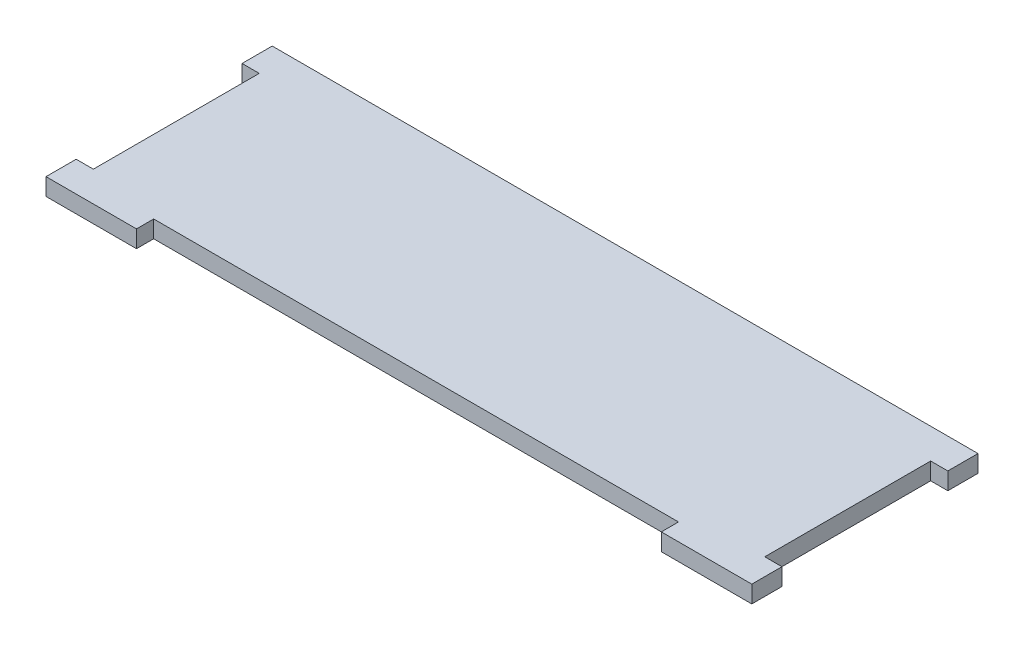
from build123d import *

# Parameters (mm, degrees)
SKETCH1_W           = 234
SKETCH1_H           = 75
BOSS_EXTRUDE1_DEPTH = 5.7
SKETCH2_W           = 5.7
SKETCH2_H           = 55
CUT_EXTRUDE1_DEPTH  = 5.7
SKETCH3_W           = 174
SKETCH3_H           = 5.7
CUT_EXTRUDE2_DEPTH  = 5.7


with BuildPart() as part:
    # Sketch1 → Boss-Extrude1 (new body)
    with BuildSketch(Plane(origin=(0, 0, 0), x_dir=(1, 0, 0), z_dir=(0, 1, 0))):
        with Locations((117, 37.5)):
            Rectangle(SKETCH1_W, SKETCH1_H)
    extrude(amount=BOSS_EXTRUDE1_DEPTH)

    # Sketch2 → Cut-Extrude1 (cut)
    with BuildSketch(Plane(origin=(0, 5.7, 0), x_dir=(1, 0, 0), z_dir=(0, 1, 0))):
        with Locations((2.85, 37.5)):
            Rectangle(SKETCH2_W, SKETCH2_H)
        with Locations((231.15, 37.5)):
            Rectangle(SKETCH2_W, SKETCH2_H)
    extrude(amount=-CUT_EXTRUDE1_DEPTH, mode=Mode.SUBTRACT)

    # Sketch3 → Cut-Extrude2 (cut)
    with BuildSketch(Plane(origin=(0, 5.7, 0), x_dir=(1, 0, 0), z_dir=(0, 1, 0))):
        with Locations((117, 2.85)):
            Rectangle(SKETCH3_W, SKETCH3_H)
    extrude(amount=-CUT_EXTRUDE2_DEPTH, mode=Mode.SUBTRACT)


solid = part.part
